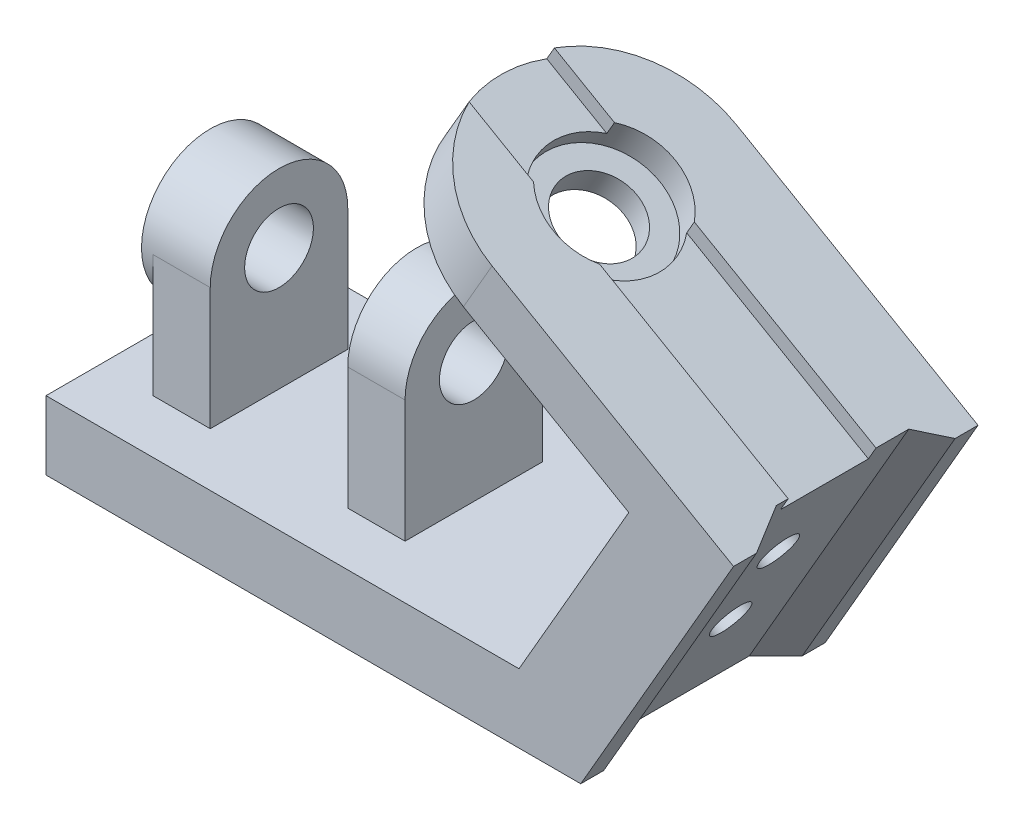
from build123d import *

# Parameters (mm, degrees)
BOSS_EXTRUDE2_DEPTH = 64
BOSS_EXTRUDE3_DEPTH = 15
SKETCH7_R           = 9
BOSS_EXTRUDE6_DEPTH = 15
BOSS_EXTRUDE7_START = 3
SKETCH8_R           = 18
SKETCH8_R_2         = 9
BOSS_EXTRUDE7_DEPTH = 3
SKETCH9_R           = 16
CUT_EXTRUDE1_DEPTH  = 8
CUT_EXTRUDE2_DEPTH  = 4
CUT_EXTRUDE3_REACH  = 167.514
SKETCH11_R          = 10
CUT_EXTRUDE4_REACH  = 174.426
CUT_EXTRUDE5_REACH  = 202.503
SKETCH13_R          = 5


with BuildPart() as part:
    # Sketch1 → Boss-Extrude2 (new body)
    with BuildSketch(Plane.XY):
        Polygon((-64.651162791, 18), (-64.651162791, 0), (75.348837209, 0), (115.348837209, 69.282032303), (52.128982733, 105.782032303), (44.628982733, 92.791651246), (87.930252922, 67.791651246), (59.183029672, 18), align=None)
    extrude(amount=-BOSS_EXTRUDE2_DEPTH)

    # Sketch3 → Boss-Extrude3 (add)
    with BuildSketch(Plane(origin=(58.837209302, 101.909035887, 0), x_dir=(0.8660254037844552, -0.4999999999999713, 0), z_dir=(0.4999999999999713, 0.8660254037844552, 0))):
        with BuildLine():
            Line((-7.745992831, 0), (-7.745992831, 64))
            ThreePointArc((-7.745992831, 64), (-39.745992831, 32), (-7.745992831, 0))
        make_face()
    extrude(amount=-BOSS_EXTRUDE3_DEPTH)

    # Sketch7 → Boss-Extrude6 (add)
    with BuildSketch(Plane.ZY.offset(50.651162791)):
        with BuildLine():
            Line((-50, 50), (-50, 18))
            Line((-50, 18), (-14, 18))
            Line((-14, 18), (-14, 50))
            ThreePointArc((-14, 50), (-32, 68), (-50, 50))
        make_face()
        with Locations((-32, 50)):
            Circle(SKETCH7_R, mode=Mode.SUBTRACT)
    boss_extrude6 = extrude(amount=-BOSS_EXTRUDE6_DEPTH)

    # Sketch8 → Boss-Extrude7 (add)
    with BuildSketch(Plane.ZY.offset(50.651162791).offset(BOSS_EXTRUDE7_START)):
        with Locations((-32, 50)):
            Circle(SKETCH8_R)
        with Locations((-32, 50)):
            Circle(SKETCH8_R_2, mode=Mode.SUBTRACT)
    extrude(amount=-BOSS_EXTRUDE7_DEPTH)

    # Mirror2: Boss-Extrude6 across plane
    add(boss_extrude6.mirror(Plane.ZY.offset(17.651162791)))

    # Sketch9 → Cut-Extrude1 (cut)
    with BuildSketch(Plane(origin=(58.837209302, 101.909035887, 0), x_dir=(0.8660254037844552, -0.4999999999999713, 0), z_dir=(0.4999999999999713, 0.8660254037844552, 0))):
        with Locations((-7.745992831, 32)):
            Circle(SKETCH9_R)
    extrude(amount=-CUT_EXTRUDE1_DEPTH, mode=Mode.SUBTRACT)

    # Sketch10 → Cut-Extrude2 (cut)
    with BuildSketch(Plane(origin=(58.837209302, 101.909035887, 0), x_dir=(0.8660254037844552, -0.4999999999999713, 0), z_dir=(0.4999999999999713, 0.8660254037844552, 0))):
        with BuildLine():
            Line((-19.818689299, 42.5), (-37.974290832, 42.5))
            ThreePointArc((-37.974290832, 42.5), (-39.72804256, 30.928321342), (-37.203589474, 19.5))
            Line((-37.203589474, 19.5), (-17.733485009, 19.5))
            ThreePointArc((-17.733485009, 19.5), (-23.680640012, 30.555348058), (-19.818689299, 42.5))
        make_face()
        with BuildLine():
            Line((65.254007169, 42.5), (4.326703637, 42.5))
            ThreePointArc((4.326703637, 42.5), (8.188654349, 30.555348058), (2.241499347, 19.5))
            Line((2.241499347, 19.5), (65.254007169, 19.5))
            Line((65.254007169, 19.5), (65.254007169, 42.5))
        make_face()
    extrude(amount=-CUT_EXTRUDE2_DEPTH, mode=Mode.SUBTRACT)

    # Sketch11 → Cut-Extrude3 (cut, up to next)
    with BuildSketch(Plane(origin=(54.837209302, 94.980832657, 0), x_dir=(0.8660254037844552, -0.49999999999997136, 0), z_dir=(0.4999999999999713, 0.8660254037844551, 0)), mode=Mode.PRIVATE) as cut_extrude3_sk1:
        with Locations((-7.745992831, 32)):
            Circle(SKETCH11_R)
    cut_extrude3_tool1 = extrude(cut_extrude3_sk1.sketch, amount=-CUT_EXTRUDE3_REACH, mode=Mode.PRIVATE) & part.part
    add(cut_extrude3_tool1.solids().sort_by_distance((48.128983, 98.853829, -32))[0], mode=Mode.SUBTRACT)

    # Sketch12 → Cut-Extrude4 (cut, up to next)
    with BuildSketch(Plane(origin=(58.837209302, 101.909035887, 0), x_dir=(0.8660254037844552, -0.4999999999999713, 0), z_dir=(0.4999999999999713, 0.8660254037844552, 0)), mode=Mode.PRIVATE) as cut_extrude4_sk1:
        Polygon((59.254007169, 16.392304845), (65.254007169, 6), (65.254007169, 58), (59.254007169, 51.067695251), align=None)
    cut_extrude4_tool1 = extrude(cut_extrude4_sk1.sketch, amount=-CUT_EXTRUDE4_REACH, mode=Mode.PRIVATE) & part.part
    add(cut_extrude4_tool1.solids().sort_by_distance((112.923861, 70.682093, -32.807368))[0], mode=Mode.SUBTRACT)

    # Sketch13 → Cut-Extrude5 (cut, up to next)
    with BuildSketch(Plane(origin=(51.315475484, -29.627003584, 0), x_dir=(0, 0, -1), z_dir=(0.8660254037844551, -0.49999999999997147, 0)), mode=Mode.PRIVATE) as cut_extrude5_sk1:
        with Locations((31.438673863, 88.674418605)):
            Circle(SKETCH13_R)
    cut_extrude5_tool1 = extrude(cut_extrude5_sk1.sketch, amount=-CUT_EXTRUDE5_REACH, mode=Mode.PRIVATE) & part.part
    # Sketch13 → Cut-Extrude5 (cut, up to next)
    with BuildSketch(Plane(origin=(51.315475484, -29.627003584, 0), x_dir=(0, 0, -1), z_dir=(0.8660254037844551, -0.49999999999997147, 0)), mode=Mode.PRIVATE) as cut_extrude5_sk2:
        with Locations((31.438673863, 63.674418605)):
            Circle(SKETCH13_R)
    cut_extrude5_tool2 = extrude(cut_extrude5_sk2.sketch, amount=-CUT_EXTRUDE5_REACH, mode=Mode.PRIVATE) & part.part
    cut_extrude5_1 = cut_extrude5_tool1.solids().sort_by_distance((95.652685, 47.167296, -31.438674))[0]
    add(cut_extrude5_1, mode=Mode.SUBTRACT)
    cut_extrude5_2 = cut_extrude5_tool2.solids().sort_by_distance((83.152685, 25.51666, -31.438674))[0]
    add(cut_extrude5_2, mode=Mode.SUBTRACT)
    cut_extrude5 = cut_extrude5_1 + cut_extrude5_2  # Cut-Extrude5 as one shape, for the pattern or mirror that repeats it

    # Mirror1: Cut-Extrude5 across plane
    add(cut_extrude5.mirror(Plane.ZY.offset(42.651162791)), mode=Mode.SUBTRACT)


solid = part.part
